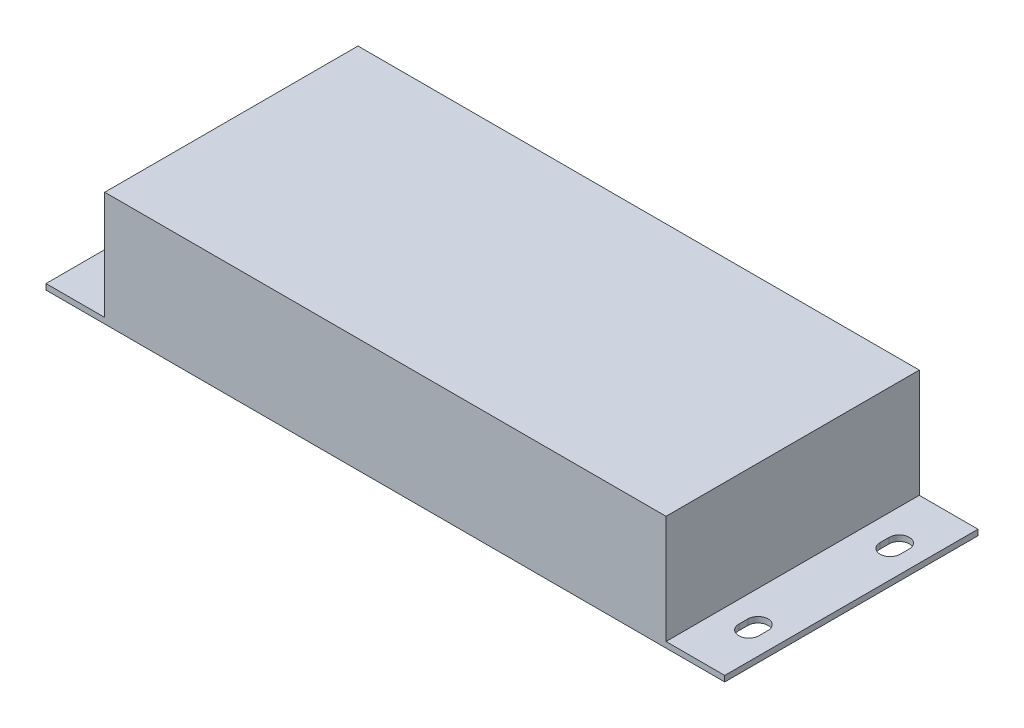
from build123d import *

# Parameters (mm, degrees)
SKETCH1_W           = 99.9236
SKETCH1_H           = 45.085
BOSS_EXTRUDE1_DEPTH = 19.304
SKETCH2_W           = 120.8278
SKETCH2_H           = 45.085
BOSS_EXTRUDE2_DEPTH = 1.016


with BuildPart() as part:
    # Sketch1 → Boss-Extrude1 (new body)
    with BuildSketch(Plane(origin=(0, 0, 0), x_dir=(1, 0, 0), z_dir=(0, 1, 0))):
        with Locations((49.9618, 22.5425)):
            Rectangle(SKETCH1_W, SKETCH1_H)
    extrude(amount=BOSS_EXTRUDE1_DEPTH)

    # Sketch2 → Boss-Extrude2 (add)
    with BuildSketch(Plane.XZ):
        with Locations((49.9618, -22.5425)):
            Rectangle(SKETCH2_W, SKETCH2_H)
        with BuildLine():
            Line((-3.7973, -9.1567), (-3.7973, -10.7823))
            ThreePointArc((-3.7973, -10.7823), (-5.588, -12.573), (-7.3787, -10.7823))
            Line((-7.3787, -10.7823), (-7.3787, -9.1567))
            ThreePointArc((-7.3787, -9.1567), (-5.588, -7.366), (-3.7973, -9.1567))
        make_face(mode=Mode.SUBTRACT)
        with BuildLine():
            Line((-3.7973, -35.9283), (-3.7973, -34.3027))
            ThreePointArc((-3.7973, -34.3027), (-5.588, -32.512), (-7.3787, -34.3027))
            Line((-7.3787, -34.3027), (-7.3787, -35.9283))
            ThreePointArc((-7.3787, -35.9283), (-5.588, -37.719), (-3.7973, -35.9283))
        make_face(mode=Mode.SUBTRACT)
        with BuildLine():
            Line((103.7209, -9.1567), (103.7209, -10.7823))
            ThreePointArc((103.7209, -10.7823), (105.5116, -12.573), (107.3023, -10.7823))
            Line((107.3023, -10.7823), (107.3023, -9.1567))
            ThreePointArc((107.3023, -9.1567), (105.5116, -7.366), (103.7209, -9.1567))
        make_face(mode=Mode.SUBTRACT)
        with BuildLine():
            Line((103.7209, -35.9283), (103.7209, -34.3027))
            ThreePointArc((103.7209, -34.3027), (105.5116, -32.512), (107.3023, -34.3027))
            Line((107.3023, -34.3027), (107.3023, -35.9283))
            ThreePointArc((107.3023, -35.9283), (105.5116, -37.719), (103.7209, -35.9283))
        make_face(mode=Mode.SUBTRACT)
    extrude(amount=BOSS_EXTRUDE2_DEPTH)


solid = part.part
